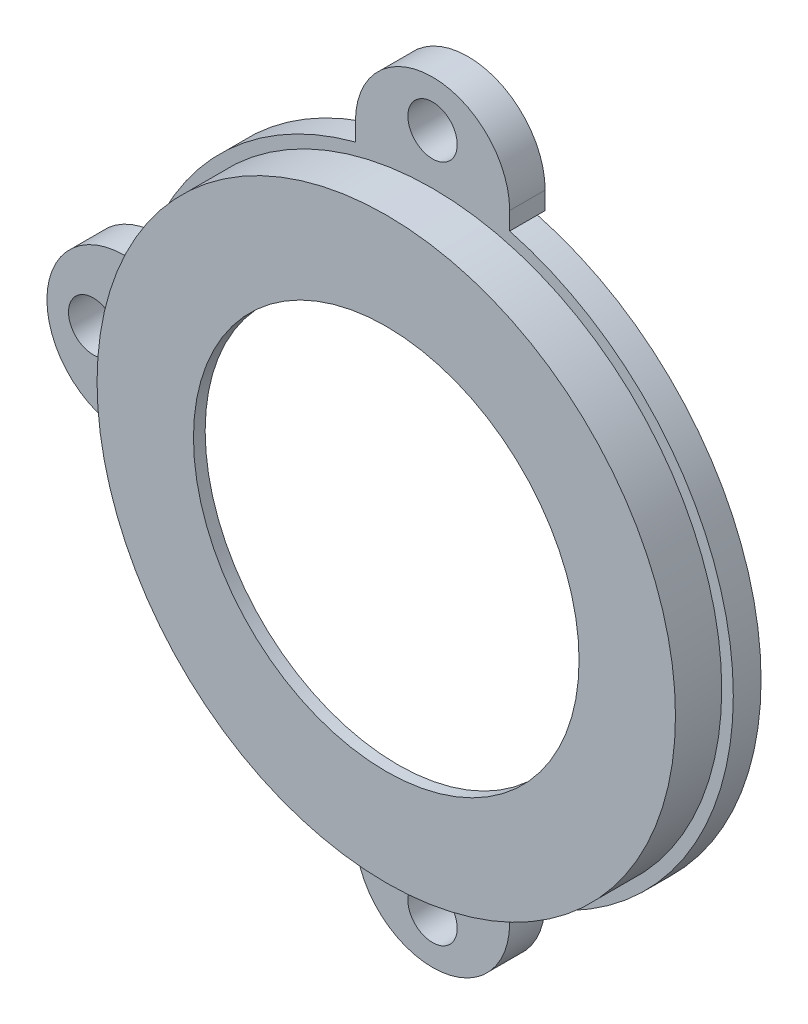
from build123d import *

# Parameters (mm, degrees)
SKETCH_2_R      = 12.5
SKETCH_2_R_2    = 1.6
EXTRUDE_1_DEPTH = 1.8
FILLET_1_R      = 5
SKETCH_7_R      = 18.75
SKETCH_7_R_2    = 12.5
EXTRUDE_2_DEPTH = 3
EXTRUDE_START   = 0.5
SKETCH_8_R      = 1.6
EXTRUDE_3_DEPTH = 0.5


with BuildPart() as part:
    # 草图2 → 凸台-拉伸1 (new body)
    with BuildSketch(Plane.XY):
        with BuildLine():
            Line((5, 18.848076825), (5, 25))
            Line((5, 25), (-5, 25))
            Line((-5, 25), (-5, 18.848076825))
            ThreePointArc((-5, 18.848076825), (-13.788582233, 13.788582233), (-18.848076825, 5))
            Line((-18.848076825, 5), (-25, 5))
            Line((-25, 5), (-25, -5))
            Line((-25, -5), (-18.848076825, -5))
            ThreePointArc((-18.848076825, -5), (-13.788582233, -13.788582233), (-5, -18.848076825))
            Line((-5, -18.848076825), (-5, -25))
            Line((-5, -25), (5, -25))
            Line((5, -25), (5, -18.848076825))
            ThreePointArc((5, -18.848076825), (19.5, 0), (5, 18.848076825))
        make_face()
        Circle(SKETCH_2_R, mode=Mode.SUBTRACT)
        with Locations((0, 22)):
            Circle(SKETCH_2_R_2, mode=Mode.SUBTRACT)
        with Locations((-22, 0)):
            Circle(SKETCH_2_R_2, mode=Mode.SUBTRACT)
        with Locations((0, -22)):
            Circle(SKETCH_2_R_2, mode=Mode.SUBTRACT)
    extrude(amount=EXTRUDE_1_DEPTH)

    # 圆角1
    fillet_1_edges = [part.edges().sort_by_distance(p)[0] for p in [
        (5, -25, 0.9),
        (-5, -25, 0.9),
        (5, 25, 0.9),
        (-5, 25, 0.9),
        (-25, -5, 0.9),
        (-25, 5, 0.9),
    ]]
    fillet(fillet_1_edges, radius=FILLET_1_R - 0.0001)  # a hair under: the kernel refuses the full size

    # 草图7 → 凸台-拉伸2 (add)
    with BuildSketch(Plane.XY.offset(1.8)):
        Circle(SKETCH_7_R)
        Circle(SKETCH_7_R_2, mode=Mode.SUBTRACT)
    extrude(amount=EXTRUDE_2_DEPTH)

    # 草图3 → 切除-旋转1 (revolve, cut)
    with BuildSketch(Plane(origin=(0, 0, 0), x_dir=(1, 0, 0), z_dir=(0, 1, 0)), mode=Mode.PRIVATE) as cut_revolve_1_sk:
        Polygon((11.186156124, 0), (19.5, 0), (11.186156124, -4.8), align=None)
    revolve(cut_revolve_1_sk.sketch.rotate(Axis((0, 0, 0), (0, 0, -1)), 180), axis=Axis((0, 0, 0), (0, 0, -1)), mode=Mode.SUBTRACT)

    # 草图8 → 凸台-拉伸3 (add)
    # profile 1 of 3: a face of its own
    with BuildSketch(Plane(origin=(0, 0, 0), x_dir=(-1, 0, 0), z_dir=(0, 0, -1)).offset(EXTRUDE_START)):
        with BuildLine():
            Line((-5, 20), (-5, 18.848076825))
            ThreePointArc((-5, 18.848076825), (0, 19.5), (5, 18.848076825))
            Line((5, 18.848076825), (5, 20))
            ThreePointArc((5, 20), (3.535533906, 23.535533906), (0, 25))
            ThreePointArc((0, 25), (-3.535533906, 23.535533906), (-5, 20))
        make_face()
        with Locations((0, 22)):
            Circle(SKETCH_8_R, mode=Mode.SUBTRACT)
    # profile 2 of 3: a face of its own
    with BuildSketch(Plane(origin=(0, 0, 0), x_dir=(-1, 0, 0), z_dir=(0, 0, -1)).offset(EXTRUDE_START)):
        with BuildLine():
            Line((20, 5), (18.848076825, 5))
            ThreePointArc((18.848076825, 5), (19.5, 0), (18.848076825, -5))
            Line((18.848076825, -5), (20, -5))
            ThreePointArc((20, -5), (23.535533906, -3.535533906), (25, 0))
            ThreePointArc((25, 0), (23.535533906, 3.535533906), (20, 5))
        make_face()
        with Locations((22, 0)):
            Circle(SKETCH_8_R, mode=Mode.SUBTRACT)
    # profile 3 of 3: a face of its own
    with BuildSketch(Plane(origin=(0, 0, 0), x_dir=(-1, 0, 0), z_dir=(0, 0, -1)).offset(EXTRUDE_START)):
        with BuildLine():
            Line((5, -20), (5, -18.848076825))
            ThreePointArc((5, -18.848076825), (0, -19.5), (-5, -18.848076825))
            Line((-5, -18.848076825), (-5, -20))
            ThreePointArc((-5, -20), (-3.535533906, -23.535533906), (0, -25))
            ThreePointArc((0, -25), (3.535533906, -23.535533906), (5, -20))
        make_face()
        with Locations((0, -22)):
            Circle(SKETCH_8_R, mode=Mode.SUBTRACT)
    extrude(amount=-EXTRUDE_3_DEPTH)


solid = part.part
